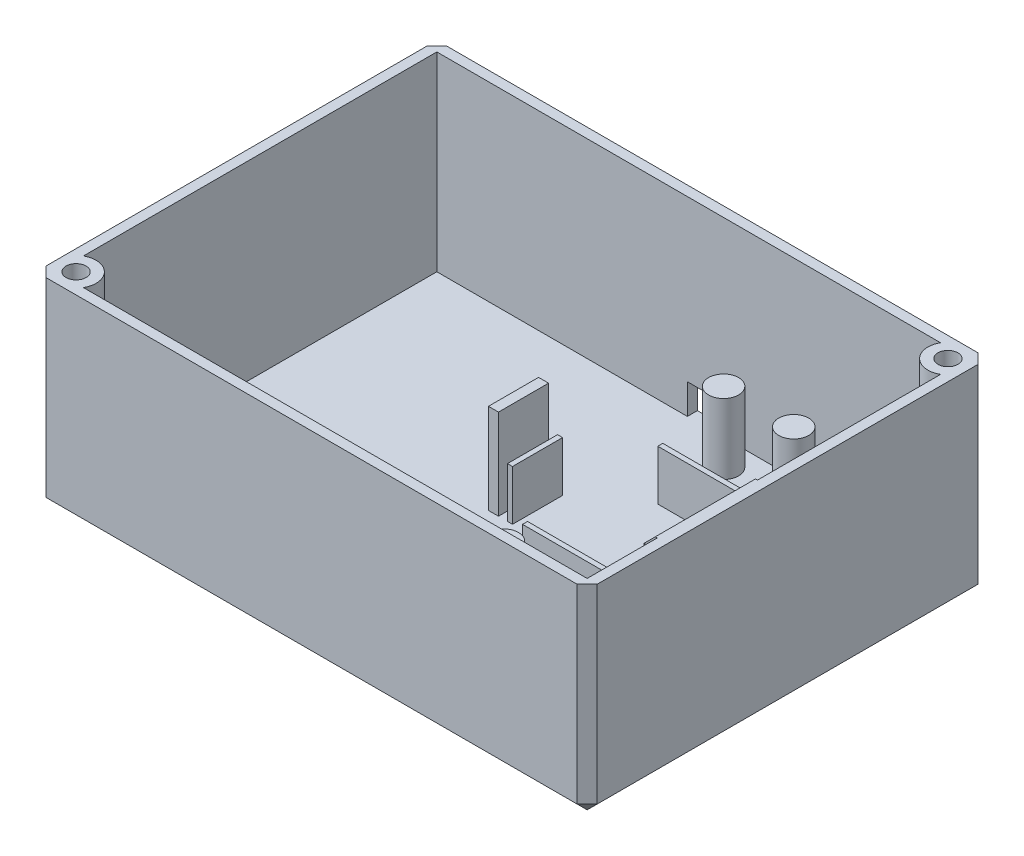
from build123d import *

# Parameters (mm, degrees)
SKETCH_1_W          = 55
SKETCH_1_H          = 40
EXTRUDE_1_DEPTH     = 20
SKETCH_2_R          = 1
CUT_EXTRUDE_2_DEPTH = 3
SHELL_START         = 1
SHELL_1_DEPTH       = 19
SHELL_1_2_DEPTH     = 15
CHAMFER_2_SIZE      = 1
SKETCH_8_W          = 3
SKETCH_8_H          = 3
CUT_EXTRUDE_5_DEPTH = 10
SKETCH_10_W         = 1.5
SKETCH_10_H         = 10
EXTRUDE_2_DEPTH     = 3
SKETCH_11_W         = 0.5
SKETCH_11_H         = 5
SKETCH_11_W_2       = 15
SKETCH_11_H_2       = 0.5
EXTRUDE_6_DEPTH     = 5
SKETCH_11_7_R       = 1.5
EXTRUDE_7_DEPTH     = 7
SKETCH_11_8_W       = 1
SKETCH_11_8_H       = 5
SKETCH_11_8_W_2     = 5
SKETCH_11_8_H_2     = 1
EXTRUDE_8_DEPTH     = 9
CUT_EXTRUDE_6_DEPTH = 10
FILLET_1_R          = 0.3


# Read off the part's stored shape, not the designer's step: 抽壳1
with BuildPart() as part:
    # 草图1 → 凸台-拉伸1 (new body)
    with BuildSketch(Plane(origin=(0, 0, 0), x_dir=(1, 0, 0), z_dir=(0, 1, 0))):
        Rectangle(SKETCH_1_W, SKETCH_1_H)
    extrude(amount=EXTRUDE_1_DEPTH)

    # 草图2 → 切除-拉伸2 (cut)
    with BuildSketch(Plane(origin=(0, 20, 0), x_dir=(1, 0, 0), z_dir=(0, 1, 0))):
        with Locations(Location((-25.5, -18, 0), (0, 0, 270))):
            Circle(SKETCH_2_R)
        with Locations(Location((25.5, 18, 0), (0, 0, 270))):
            Circle(SKETCH_2_R)
    extrude(amount=-CUT_EXTRUDE_2_DEPTH, mode=Mode.SUBTRACT)

    # 抽壳1 outline → 抽壳1 (cut)
    with BuildSketch(Plane(origin=(0, 0, 0), x_dir=(1, 0, 0), z_dir=(0, 1, 0)).offset(SHELL_START)):
        with BuildLine():
            ThreePointArc((26.5, 16.267949192), (24.085786438, 16.585786438), (23.767949192, 19))
            Line((23.767949192, 19), (-26.5, 19))
            Line((-26.5, 19), (-26.5, -16.267949192))
            ThreePointArc((-26.5, -16.267949192), (-24.085786438, -16.585786438), (-23.767949192, -19))
            Line((-23.767949192, -19), (26.5, -19))
            Line((26.5, -19), (26.5, 16.267949192))
        make_face()
    extrude(amount=SHELL_1_DEPTH, mode=Mode.SUBTRACT)

    # Shell 1 2 outline → Shell 1 2 (cut)
    with BuildSketch(Plane(origin=(0, 0, 0), x_dir=(1, 0, 0), z_dir=(0, 1, 0)).offset(SHELL_START)):
        with BuildLine():
            Line((26.5, 16.267949192), (26.5, 19))
            Line((26.5, 19), (23.767949192, 19))
            ThreePointArc((23.767949192, 19), (24.085786438, 16.585786438), (26.5, 16.267949192))
        make_face()
        with BuildLine():
            ThreePointArc((-23.767949192, -19), (-24.085786438, -16.585786438), (-26.5, -16.267949192))
            Line((-26.5, -16.267949192), (-26.5, -19))
            Line((-26.5, -19), (-23.767949192, -19))
        make_face()
    extrude(amount=SHELL_1_2_DEPTH, mode=Mode.SUBTRACT)

    # 倒角2
    chamfer_2_edges = [part.edges().sort_by_distance(p)[0] for p in [
        (0, 0, -20),
        (27.5, 0, 0),
        (0, 0, 20),
        (-27.5, 0, 0),
        (-27.5, 10, -20),
        (27.5, 10, -20),
        (27.5, 10, 20),
        (-27.5, 10, 20),
    ]]
    chamfer(chamfer_2_edges, length=CHAMFER_2_SIZE)

    # 草图8 → 切除-拉伸5 (cut)
    with BuildSketch(Plane(origin=(0, 0, -20), x_dir=(-1, 0, 0), z_dir=(0, 0, -1))):
        with Locations((0, 2.5)):
            Rectangle(SKETCH_8_W, SKETCH_8_H)
    extrude(amount=-CUT_EXTRUDE_5_DEPTH, mode=Mode.SUBTRACT)

    # 草图10 → 凸台-拉伸2 (add)
    with BuildSketch(Plane(origin=(0, 20, 0), x_dir=(1, 0, 0), z_dir=(0, 1, 0))):
        with Locations((25.75, -7)):
            Rectangle(SKETCH_10_W, SKETCH_10_H)
    extrude(amount=-EXTRUDE_2_DEPTH)

    # 草图11 → 凸台-拉伸6 (add)
    with BuildSketch(Plane(origin=(0, 1, 0), x_dir=(1, 0, 0), z_dir=(0, 1, 0))):
        with Locations((25.35, 3.45)):
            Rectangle(SKETCH_11_W, SKETCH_11_H)
        with Locations((12.1, 10.2)):
            Rectangle(SKETCH_11_W_2, SKETCH_11_H_2)
        with Locations((12.1, -3.3)):
            Rectangle(SKETCH_11_W_2, SKETCH_11_H_2)
        with Locations((-1.15, 3.45)):
            Rectangle(SKETCH_11_W, SKETCH_11_H)
    extrude(amount=EXTRUDE_6_DEPTH)

    # 草图11<7> → 凸台-拉伸7 (add)
    with BuildSketch(Plane(origin=(0, 1, 0), x_dir=(1, 0, 0), z_dir=(0, 1, 0))):
        with Locations(Location((4.7, 16.413896805, 0), (0, 0, 270))):
            Circle(SKETCH_11_7_R)
        with Locations(Location((11.7, 16.413896805, 0), (0, 0, 270))):
            Circle(SKETCH_11_7_R)
        with Locations(Location((18.7, 16.413896805, 0), (0, 0, 270))):
            Circle(SKETCH_11_7_R)
        with Locations(Location((17.1, -7.952490826, 0), (0, 0, 270))):
            Circle(SKETCH_11_7_R)
        with Locations(Location((7.1, -7.952490826, 0), (0, 0, 270))):
            Circle(SKETCH_11_7_R)
    extrude(amount=EXTRUDE_7_DEPTH)

    # 草图11<8> → 凸台-拉伸8 (add)
    with BuildSketch(Plane(origin=(0, 1, 0), x_dir=(1, 0, 0), z_dir=(0, 1, 0))):
        with Locations((-2.8, 3.45)):
            Rectangle(SKETCH_11_8_W, SKETCH_11_8_H)
        with Locations((12.1, -12.6)):
            Rectangle(SKETCH_11_8_W_2, SKETCH_11_8_H_2)
    extrude(amount=EXTRUDE_8_DEPTH)

    # 草图12 → 切除-拉伸6 (cut)
    with BuildSketch(Plane.XY.offset(12)):
        Polygon((26.3, 20), (25, 18.7), (25, 20), align=None)
    extrude(amount=-CUT_EXTRUDE_6_DEPTH, mode=Mode.SUBTRACT)

    # 圆角1
    fillet_1_edges = [part.edges().sort_by_distance(p)[0] for p in [
        (25, 18.7, 7),
        (25, 17, 7),
        (25, 17.85, 12),
        (25, 17.85, 2),
    ]]
    fillet(fillet_1_edges, radius=FILLET_1_R)


solid = part.part
